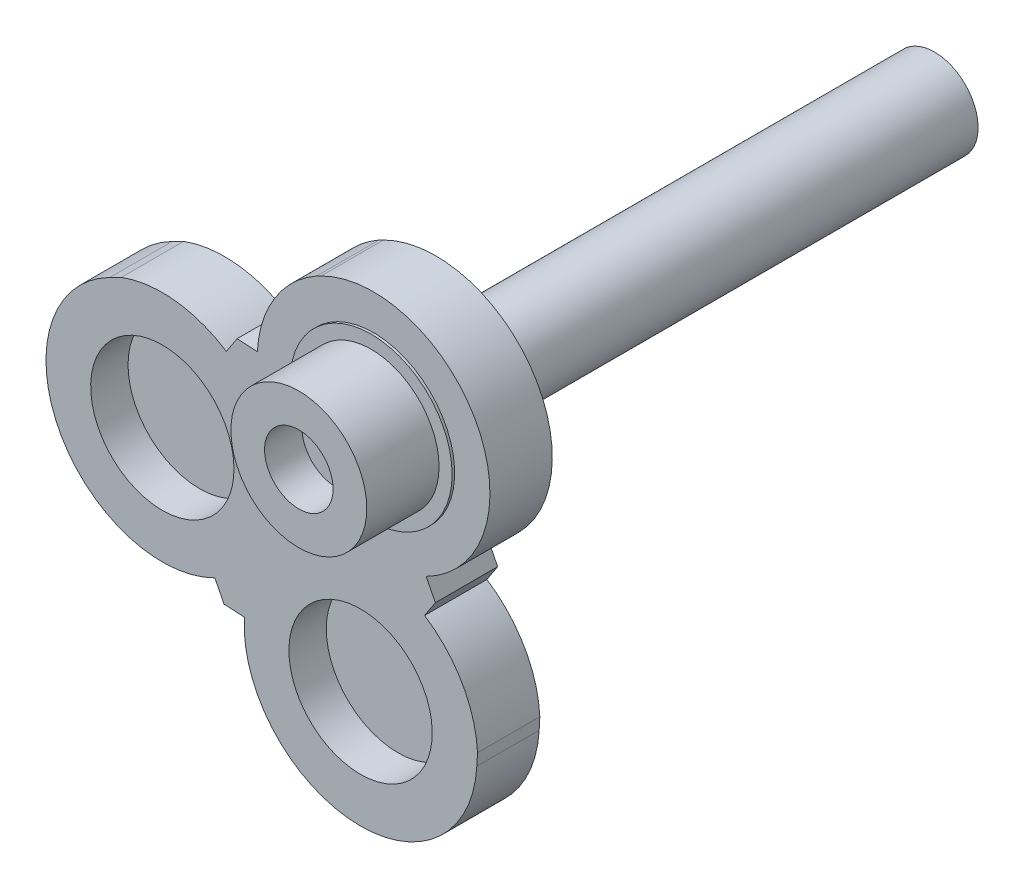
from build123d import *

# Parameters (mm, degrees)
SKETCH1_R           = 6.5
BOSS_EXTRUDE1_DEPTH = 11
SKETCH2_R           = 2.75
CUT_EXTRUDE1_DEPTH  = 3
SKETCH3_OUTSIDE_W   = 19.284
SKETCH3_OUTSIDE_H   = 19.284
SKETCH3_OUTSIDE_R   = 5.45
CUT_EXTRUDE2_DEPTH  = 5.8
SKETCH4_R           = 3.5
BOSS_EXTRUDE2_DEPTH = 40
JOIN2_OUTLINE_R     = 5.75
JOIN2_OUTLINE_R_2   = 6.5
JOIN2_DEPTH         = 5
JOIN2_START         = -2
JOIN2_2_OUTLINE_R   = 5.75
JOIN2_2_DEPTH       = 4


# Read off the part's stored shape, not the designer's step: Join2
with BuildPart() as part:
    # Sketch1 → Boss-Extrude1 (new body)
    with BuildSketch(Plane.XY):
        Circle(SKETCH1_R)
    extrude(amount=BOSS_EXTRUDE1_DEPTH)

    # Sketch2 → Cut-Extrude1 (cut)
    with BuildSketch(Plane.XY.offset(11)):
        Circle(SKETCH2_R)
    extrude(amount=-CUT_EXTRUDE1_DEPTH, mode=Mode.SUBTRACT)

    # Sketch3 outside → Cut-Extrude2 (cut)
    with BuildSketch(Plane.XY.offset(11)):
        Rectangle(SKETCH3_OUTSIDE_W, SKETCH3_OUTSIDE_H)
        Circle(SKETCH3_OUTSIDE_R, mode=Mode.SUBTRACT)
    extrude(amount=-CUT_EXTRUDE2_DEPTH, mode=Mode.SUBTRACT)

    # Sketch4 → Boss-Extrude2 (add)
    with BuildSketch(Plane(origin=(0, 0, 0), x_dir=(-1, 0, 0), z_dir=(0, 0, -1))):
        Circle(SKETCH4_R)
    extrude(amount=BOSS_EXTRUDE2_DEPTH)

    # Join2 outline → Join2 (add)
    with BuildSketch(Plane.XY):
        with BuildLine():
            Line((4.091169505, -11.107165908), (4.953212207, -9.78769749))
            Line((4.953212207, -9.78769749), (4.215242705, -8.329447379))
            ThreePointArc((4.215242705, -8.329447379), (8.329447379, 4.215242705), (-4.215242705, 8.329447379))
            Line((-4.215242705, 8.329447379), (-4.56983635, 8.149999907))
            ThreePointArc((-4.56983635, 8.149999907), (-7.929245952, 4.942970907), (-9.329576894, 0.51468217))
            Line((-9.329576894, 0.51468217), (-10.953000775, 0.604241143))
            Line((-10.953000775, 0.604241143), (-11.815043478, -0.715227275))
            ThreePointArc((-11.815043478, -0.715227275), (-15.913949613, 0.756712749), (-20.236162848, 0.221818664))
            Line((-20.236162848, 0.221818664), (-21.168032047, -0.249767825))
            ThreePointArc((-21.168032047, -0.249767825), (-25.282236722, -12.794457909), (-12.737546638, -16.908662583))
            Line((-12.737546638, -16.908662583), (-11.999577135, -18.366912694))
            Line((-11.999577135, -18.366912694), (-10.376153254, -18.456471667))
            ThreePointArc((-10.376153254, -18.456471667), (-1.56125853, -28.300730731), (8.283000534, -19.485836007))
            Line((8.283000534, -19.485836007), (8.336201554, -18.521468017))
            ThreePointArc((8.336201554, -18.521468017), (7.105378721, -14.303781228), (4.091169505, -11.107165908))
        make_face()
        with Locations((-1.04657636, -18.971153837)):
            Circle(JOIN2_OUTLINE_R, mode=Mode.SUBTRACT)
        with Locations((-16.952789342, -8.579215204)):
            Circle(JOIN2_OUTLINE_R, mode=Mode.SUBTRACT)
        Circle(JOIN2_OUTLINE_R_2, mode=Mode.SUBTRACT)
    extrude(amount=JOIN2_DEPTH)

    # Join2 2 outline → Join2 2 (add)
    with BuildSketch(Plane.XY.offset(JOIN2_START)):
        with Locations((-1.04657636, -18.971153837)):
            Circle(JOIN2_2_OUTLINE_R)
        with Locations((-16.952789342, -8.579215204)):
            Circle(JOIN2_2_OUTLINE_R)
    extrude(amount=JOIN2_2_DEPTH)


solid = part.part
